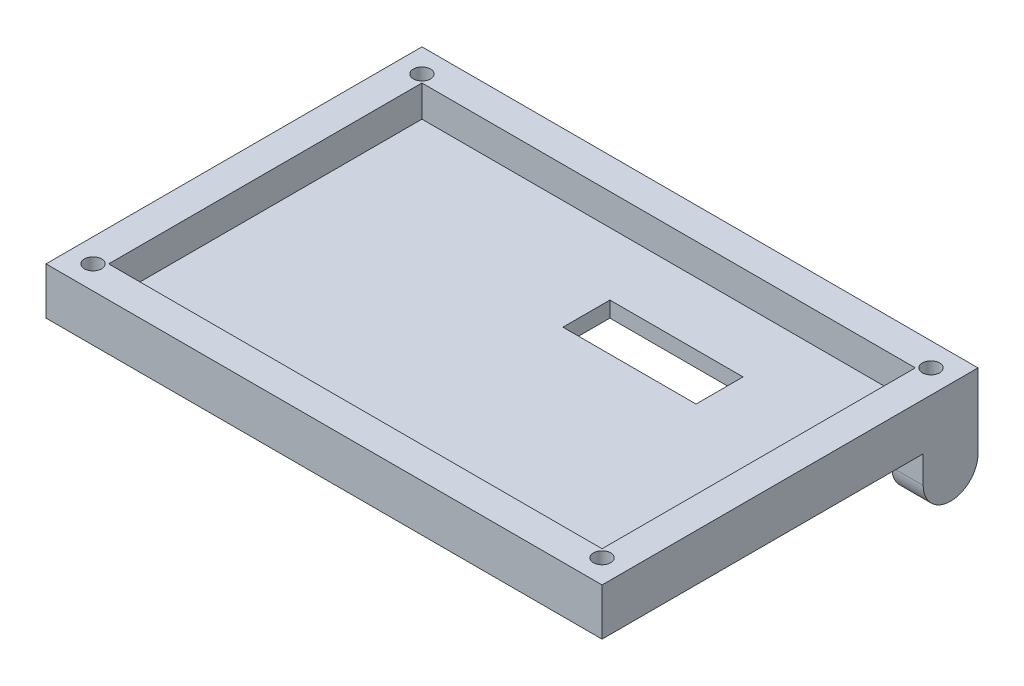
from build123d import *

# Parameters (mm, degrees)
SKETCH_1_W           = 35.5
SKETCH_1_H           = 24
EXTRUDE_1_DEPTH      = 3
SKETCH_2_W           = 31.5
SKETCH_2_H           = 20
CUT_EXTRUDE_1_DEPTH  = 2
SKETCH_3_R           = 0.55
CUT_EXTRUDE_2_DEPTH  = 2
SKETCH_4_W           = 2
SKETCH_4_H           = 3.5
EXTRUDE_2_DEPTH      = 3.5
CUT_EXTRUDE_3_DEPTH  = 2
CUT_EXTRUDE_4_DEPTH  = 2
CUT_EXTRUDE_START    = -2
CUT_EXTRUDE_5_DEPTH  = 2
CUT_EXTRUDE_6_DEPTH  = 2
SKETCH_10_R          = 0.6
CUT_EXTRUDE_8_DEPTH  = 1.5
SKETCH_11_W          = 8.5
SKETCH_11_H          = 3
CUT_EXTRUDE_9_DEPTH  = 2
CUT_EXTRUDE_START_2  = -1.5
SKETCH_12_R          = 0.6
CUT_EXTRUDE_10_DEPTH = 1.5


with BuildPart() as part:
    # 草图1 → 凸台-拉伸1 (new body)
    with BuildSketch(Plane(origin=(0, 0, 0), x_dir=(1, 0, 0), z_dir=(0, 1, 0))):
        Rectangle(SKETCH_1_W, SKETCH_1_H)
    extrude(amount=EXTRUDE_1_DEPTH)

    # 草图2 → 切除-拉伸1 (cut)
    with BuildSketch(Plane(origin=(0, 3, 0), x_dir=(1, 0, 0), z_dir=(0, 1, 0))):
        Rectangle(SKETCH_2_W, SKETCH_2_H)
    extrude(amount=-CUT_EXTRUDE_1_DEPTH, mode=Mode.SUBTRACT)

    # 草图3 → 切除-拉伸2 (cut)
    with BuildSketch(Plane(origin=(0, 3, 0), x_dir=(1, 0, 0), z_dir=(0, 1, 0))):
        with Locations((-16.25, 10.5)):
            Circle(SKETCH_3_R)
        with Locations((-16.25, -10.5)):
            Circle(SKETCH_3_R)
        with Locations((16.25, -10.5)):
            Circle(SKETCH_3_R)
        with Locations((16.25, 10.5)):
            Circle(SKETCH_3_R)
    extrude(amount=-CUT_EXTRUDE_2_DEPTH, mode=Mode.SUBTRACT)

    # 草图4 → 凸台-拉伸2 (add)
    with BuildSketch(Plane.XZ):
        with Locations((-16.75, -10.25)):
            Rectangle(SKETCH_4_W, SKETCH_4_H)
        with Locations((16.75, -10.25)):
            Rectangle(SKETCH_4_W, SKETCH_4_H)
    extrude(amount=EXTRUDE_2_DEPTH)

    # 草图5 → 切除-拉伸3 (cut)
    with BuildSketch(Plane.ZY.offset(17.75)):
        with BuildLine():
            Line((-12, -1.75), (-12, -3.5))
            Line((-12, -3.5), (-10.25, -3.5))
            ThreePointArc((-10.25, -3.5), (-11.487436867, -2.987436867), (-12, -1.75))
        make_face()
    extrude(amount=-CUT_EXTRUDE_3_DEPTH, mode=Mode.SUBTRACT)

    # 草图6 → 切除-拉伸4 (cut)
    with BuildSketch(Plane.ZY.offset(17.75)):
        with BuildLine():
            Line((-8.5, -3.5), (-10.25, -3.5))
            ThreePointArc((-10.25, -3.5), (-9.012563133, -2.987436867), (-8.5, -1.75))
            Line((-8.5, -1.75), (-8.5, -3.5))
        make_face()
    extrude(amount=-CUT_EXTRUDE_4_DEPTH, mode=Mode.SUBTRACT)

    # 草图7 → 切除-拉伸5 (cut)
    with BuildSketch(Plane(origin=(17.75, 0, 0), x_dir=(0, 0, -1), z_dir=(1, 0, 0)).offset(CUT_EXTRUDE_START)):
        with BuildLine():
            Line((8.5, -3.5), (10.25, -3.5))
            ThreePointArc((10.25, -3.5), (9.012563133, -2.987436867), (8.5, -1.75))
            Line((8.5, -1.75), (8.5, -3.5))
        make_face()
    extrude(amount=CUT_EXTRUDE_5_DEPTH, mode=Mode.SUBTRACT)

    # 草图8 → 切除-拉伸6 (cut)
    with BuildSketch(Plane(origin=(17.75, 0, 0), x_dir=(0, 0, -1), z_dir=(1, 0, 0)).offset(CUT_EXTRUDE_START)):
        with BuildLine():
            Line((12, -3.5), (10.25, -3.5))
            ThreePointArc((10.25, -3.5), (11.487436867, -2.987436867), (12, -1.75))
            Line((12, -1.75), (12, -3.5))
        make_face()
    extrude(amount=CUT_EXTRUDE_6_DEPTH, mode=Mode.SUBTRACT)

    # 草图10 → 切除-拉伸8 (cut)
    with BuildSketch(Plane.ZY.offset(-15.75)):
        with Locations((-10.25, -1.75)):
            Circle(SKETCH_10_R)
    extrude(amount=-CUT_EXTRUDE_8_DEPTH, mode=Mode.SUBTRACT)

    # 草图11 → 切除-拉伸9 (cut)
    with BuildSketch(Plane.XZ):
        with Locations((4.5, -4.5)):
            Rectangle(SKETCH_11_W, SKETCH_11_H)
    extrude(amount=-CUT_EXTRUDE_9_DEPTH, mode=Mode.SUBTRACT)

    # 草图12 → 切除-拉伸10 (cut)
    with BuildSketch(Plane(origin=(-15.75, 0, 0), x_dir=(0, 0, -1), z_dir=(1, 0, 0)).offset(CUT_EXTRUDE_START_2)):
        with Locations((10.25, -1.75)):
            Circle(SKETCH_12_R)
    extrude(amount=CUT_EXTRUDE_10_DEPTH, mode=Mode.SUBTRACT)


solid = part.part
